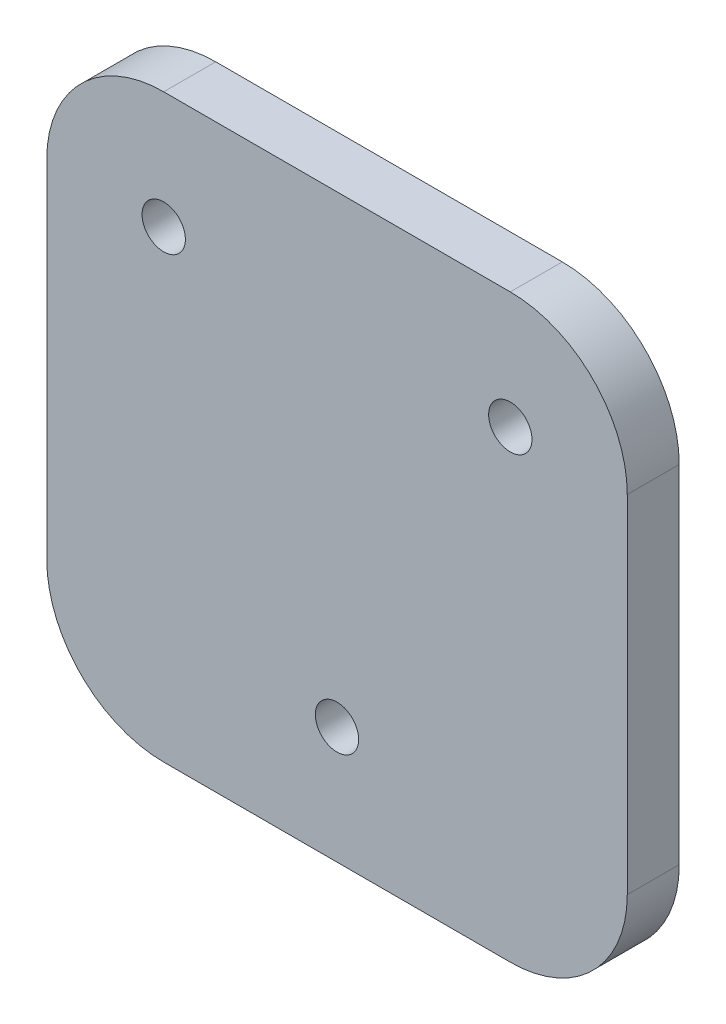
from build123d import *

# Parameters (mm, degrees)
ESBO_O1_R                = 2.5
RESSALTO_EXTRUS_O1_DEPTH = 6


with BuildPart() as part:
    # Esboço1 → Ressalto-extrusão1 (new body)
    with BuildSketch(Plane.XY):
        with BuildLine():
            Line((-20, 33.5), (20, 33.5))
            ThreePointArc((20, 33.5), (29.545941546, 29.545941546), (33.5, 20))
            Line((33.5, 20), (33.5, -20))
            ThreePointArc((33.5, -20), (29.545941546, -29.545941546), (20, -33.5))
            Line((20, -33.5), (-20, -33.5))
            ThreePointArc((-20, -33.5), (-29.545941546, -29.545941546), (-33.5, -20))
            Line((-33.5, -20), (-33.5, 20))
            ThreePointArc((-33.5, 20), (-29.545941546, 29.545941546), (-20, 33.5))
        make_face()
        with Locations((-20, 20)):
            Circle(ESBO_O1_R, mode=Mode.SUBTRACT)
        with Locations((20, 20)):
            Circle(ESBO_O1_R, mode=Mode.SUBTRACT)
        with Locations((0, -20)):
            Circle(ESBO_O1_R, mode=Mode.SUBTRACT)
    extrude(amount=RESSALTO_EXTRUS_O1_DEPTH)


solid = part.part
